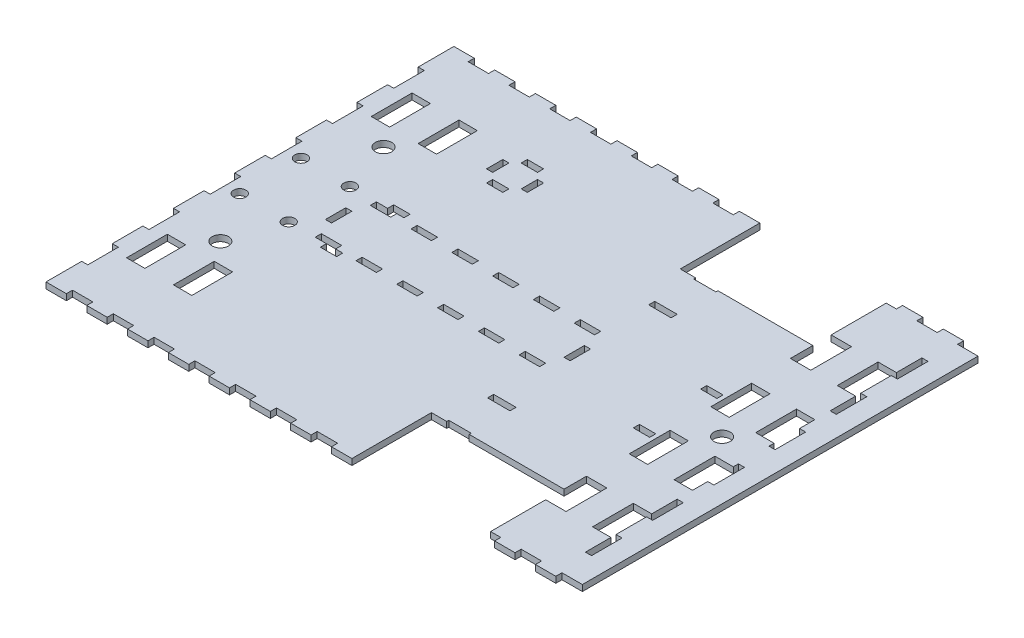
from build123d import *

# Parameters (mm, degrees)
SKETCH3_R             = 3
SKETCH3_W             = 10
SKETCH3_H             = 3
SKETCH3_W_2           = 3
SKETCH3_H_2           = 15
SKETCH3_H_3           = 10
BOSS_EXTRUDE1_DEPTH   = 3
SKETCH5_W             = 11
SKETCH5_H             = 3
CUT_EXTRUDE2_DEPTH    = 10
CROQUIS1_W            = 3
CROQUIS1_H            = 15
CORTAR_EXTRUIR1_DEPTH = 10
CROQUIS2_R            = 4
CROQUIS2_W            = 9
CROQUIS2_H            = 20
CROQUIS2_W_2          = 10
CROQUIS2_W_3          = 8
CROQUIS2_H_2          = 3
CROQUIS2_W_4          = 3
CROQUIS2_H_3          = 8
CORTAR_EXTRUIR2_DEPTH = 10


with BuildPart() as part:
    # Sketch3 → Boss-Extrude1 (new body)
    with BuildSketch(Plane(origin=(0, 0, 0), x_dir=(1, 0, 0), z_dir=(0, 1, 0))):
        Polygon((-300, 97), (-300, -97), (-300, -100), (-290, -100), (-290, -97), (-280, -97), (-280, -100), (-270, -100), (-270, -97), (-260, -97), (-260, -100), (-250, -100), (-250, -97), (-240, -97), (-240, -100), (-230, -100), (-230, -97), (-220, -97), (-220, -100), (-210, -100), (-210, -97), (-200, -97), (-200, -100), (-190, -100), (-190, -97), (-180, -97), (-180, -100), (-170, -100), (-170, -97), (-160, -97), (-160, -100), (-150, -100), (-150, -97), (-140, -97), (-140, -100), (-130, -100), (-130, -97), (-120, -97), (-120, -100), (-110, -100), (-110, -97), (-100, -97), (-100, -100), (-90, -100), (-90, -97), (-80, -97), (-80, -100), (-70, -100), (-70, -97), (-60, -97), (-60, -100), (-50, -100), (-50, -97), (-40, -97), (-40, 97), (-50, 97), (-50, 100), (-60, 100), (-60, 97), (-70, 97), (-70, 100), (-80, 100), (-80, 97), (-90, 97), (-90, 100), (-100, 100), (-100, 97), (-110, 97), (-110, 100), (-120, 100), (-120, 97), (-130, 97), (-130, 100), (-140, 100), (-140, 97), (-150, 97), (-150, 100), (-160, 100), (-160, 97), (-170, 97), (-170, 100), (-180, 100), (-180, 97), (-190, 97), (-190, 100), (-200, 100), (-200, 97), (-210, 97), (-210, 100), (-220, 100), (-220, 97), (-230, 97), (-230, 100), (-240, 100), (-240, 97), (-250, 97), (-250, 100), (-260, 100), (-260, 97), (-270, 97), (-270, 100), (-280, 100), (-280, 97), (-290, 97), (-290, 100), (-300, 100), align=None)
        with Locations((-290, -15)):
            Circle(SKETCH3_R, mode=Mode.SUBTRACT)
        with Locations((-266, -15)):
            Circle(SKETCH3_R, mode=Mode.SUBTRACT)
        with Locations((-248, -13.5)):
            Rectangle(SKETCH3_W, SKETCH3_H, mode=Mode.SUBTRACT)
        Polygon((-255, 5), (-255, 0), (-255, -5), (-258, -5), (-258, 0), (-258, 5), align=None, mode=Mode.SUBTRACT)
        with Locations((-228, -13.5)):
            Rectangle(SKETCH3_W, SKETCH3_H, mode=Mode.SUBTRACT)
        with Locations((-208, -13.5)):
            Rectangle(SKETCH3_W, SKETCH3_H, mode=Mode.SUBTRACT)
        with Locations((-188, -13.5)):
            Rectangle(SKETCH3_W, SKETCH3_H, mode=Mode.SUBTRACT)
        with Locations((-51.5, -75)):
            Rectangle(SKETCH3_W_2, SKETCH3_H_2, mode=Mode.SUBTRACT)
        with Locations((-168, -13.5)):
            Rectangle(SKETCH3_W, SKETCH3_H, mode=Mode.SUBTRACT)
        with Locations((-148, -13.5)):
            Rectangle(SKETCH3_W, SKETCH3_H, mode=Mode.SUBTRACT)
        with Locations((-139.5, 0)):
            Rectangle(SKETCH3_W_2, SKETCH3_H_3, mode=Mode.SUBTRACT)
        with Locations((-51.5, -45)):
            Rectangle(SKETCH3_W_2, SKETCH3_H_2, mode=Mode.SUBTRACT)
        with Locations((-51.5, -15)):
            Rectangle(SKETCH3_W_2, SKETCH3_H_2, mode=Mode.SUBTRACT)
        with Locations((-290, 15)):
            Circle(SKETCH3_R, mode=Mode.SUBTRACT)
        with Locations((-266, 15)):
            Circle(SKETCH3_R, mode=Mode.SUBTRACT)
        with Locations((-248, 13.5)):
            Rectangle(SKETCH3_W, SKETCH3_H, mode=Mode.SUBTRACT)
        with Locations((-228, 13.5)):
            Rectangle(SKETCH3_W, SKETCH3_H, mode=Mode.SUBTRACT)
        with Locations((-208, 13.5)):
            Rectangle(SKETCH3_W, SKETCH3_H, mode=Mode.SUBTRACT)
        with Locations((-188, 13.5)):
            Rectangle(SKETCH3_W, SKETCH3_H, mode=Mode.SUBTRACT)
        with Locations((-168, 13.5)):
            Rectangle(SKETCH3_W, SKETCH3_H, mode=Mode.SUBTRACT)
        with Locations((-148, 13.5)):
            Rectangle(SKETCH3_W, SKETCH3_H, mode=Mode.SUBTRACT)
        with Locations((-51.5, 15)):
            Rectangle(SKETCH3_W_2, SKETCH3_H_2, mode=Mode.SUBTRACT)
        with Locations((-51.5, 45)):
            Rectangle(SKETCH3_W_2, SKETCH3_H_2, mode=Mode.SUBTRACT)
        with Locations((-51.5, 75)):
            Rectangle(SKETCH3_W_2, SKETCH3_H_2, mode=Mode.SUBTRACT)
    extrude(amount=BOSS_EXTRUDE1_DEPTH)

    # Sketch5 → Cut-Extrude2 (cut)
    with BuildSketch(Plane(origin=(0, 3, 0), x_dir=(1, 0, 0), z_dir=(0, 1, 0))):
        with Locations((-137, -39.5)):
            Rectangle(SKETCH5_W, SKETCH5_H)
        Polygon((-131.5, -60), (-142.5, -60), (-142.5, -61), (-150, -61), (-150, -97), (-85, -97), (-85, -61), (-131.5, -61), align=None)
        Polygon((-131.5, 61), (-85, 61), (-85, 97), (-150, 97), (-150, 61), (-142.5, 61), (-142.5, 60), (-131.5, 60), align=None)
        with Locations((-137, 39.5)):
            Rectangle(SKETCH5_W, SKETCH5_H)
    extrude(amount=-CUT_EXTRUDE2_DEPTH, mode=Mode.SUBTRACT)


with BuildPart() as cut_extrude2_kept_piece:
    # of the separate pieces the step leaves, the one the design keeps (cut_extrude2_pieces_kept)
    add(part.part.solids().sort_by_distance((-300, 0, -100))[0])

    # Croquis1 → Cortar-Extruir1 (cut)
    with BuildSketch(Plane(origin=(0, 3, 0), x_dir=(1, 0, 0), z_dir=(0, 1, 0))):
        with Locations((-298.5, -75)):
            Rectangle(CROQUIS1_W, CROQUIS1_H)
        with Locations((-298.5, 45)):
            Rectangle(CROQUIS1_W, CROQUIS1_H)
        with Locations((-298.5, 15)):
            Rectangle(CROQUIS1_W, CROQUIS1_H)
        with Locations((-298.5, -15)):
            Rectangle(CROQUIS1_W, CROQUIS1_H)
        with Locations((-298.5, 75)):
            Rectangle(CROQUIS1_W, CROQUIS1_H)
        with Locations((-298.5, -45)):
            Rectangle(CROQUIS1_W, CROQUIS1_H)
    extrude(amount=-CORTAR_EXTRUIR1_DEPTH, mode=Mode.SUBTRACT)

    # Croquis2 → Cortar-Extruir2 (cut)
    with BuildSketch(Plane(origin=(0, 3, 0), x_dir=(1, 0, 0), z_dir=(0, 1, 0))):
        with Locations((-68.5, 0)):
            Circle(CROQUIS2_R)
        with Locations((-274.5, -40)):
            Circle(CROQUIS2_R)
        with Locations((-274.5, 40)):
            Circle(CROQUIS2_R)
        with Locations((-57.5, -20)):
            Rectangle(CROQUIS2_W, CROQUIS2_H)
        with Locations((-57.5, -60)):
            Rectangle(CROQUIS2_W, CROQUIS2_H)
        with Locations((-57.5, 60)):
            Rectangle(CROQUIS2_W, CROQUIS2_H)
        with Locations((-57.5, 20)):
            Rectangle(CROQUIS2_W, CROQUIS2_H)
        with Locations((-80, 60)):
            Rectangle(CROQUIS2_W_2, CROQUIS2_H)
        with Locations((-79.5, 20)):
            Rectangle(CROQUIS2_W, CROQUIS2_H)
        with Locations((-79.5, -20)):
            Rectangle(CROQUIS2_W, CROQUIS2_H)
        with Locations((-80, -60)):
            Rectangle(CROQUIS2_W_2, CROQUIS2_H)
        Polygon((-243.49, 18), (-247.49, 18), (-247.49, 15), (-239.49, 15), (-239.49, 18), align=None)
        with Locations((-263, -60)):
            Rectangle(CROQUIS2_W, CROQUIS2_H)
        Polygon((-239.49, -18), (-243.49, -18), (-247.49, -18), (-247.49, -15), (-239.49, -15), align=None)
        with Locations((-263, 60)):
            Rectangle(CROQUIS2_W, CROQUIS2_H)
        with Locations((-90, 16.5)):
            Rectangle(CROQUIS2_W_3, CROQUIS2_H_2)
        with Locations((-286, 60)):
            Rectangle(CROQUIS2_W, CROQUIS2_H)
        with Locations((-286, -60)):
            Rectangle(CROQUIS2_W, CROQUIS2_H)
        with Locations((-90, -16.5)):
            Rectangle(CROQUIS2_W_3, CROQUIS2_H_2)
        with Locations((-230, 68.5)):
            Rectangle(CROQUIS2_W_3, CROQUIS2_H_2)
        with Locations((-238.5, 60)):
            Rectangle(CROQUIS2_W_4, CROQUIS2_H_3)
        with Locations((-221.5, 60)):
            Rectangle(CROQUIS2_W_4, CROQUIS2_H_3)
        Polygon((-234, 50), (-226, 50), (-226, 53), (-230, 53), (-234, 53), align=None)
    extrude(amount=-CORTAR_EXTRUIR2_DEPTH, mode=Mode.SUBTRACT)


solid = cut_extrude2_kept_piece.part
